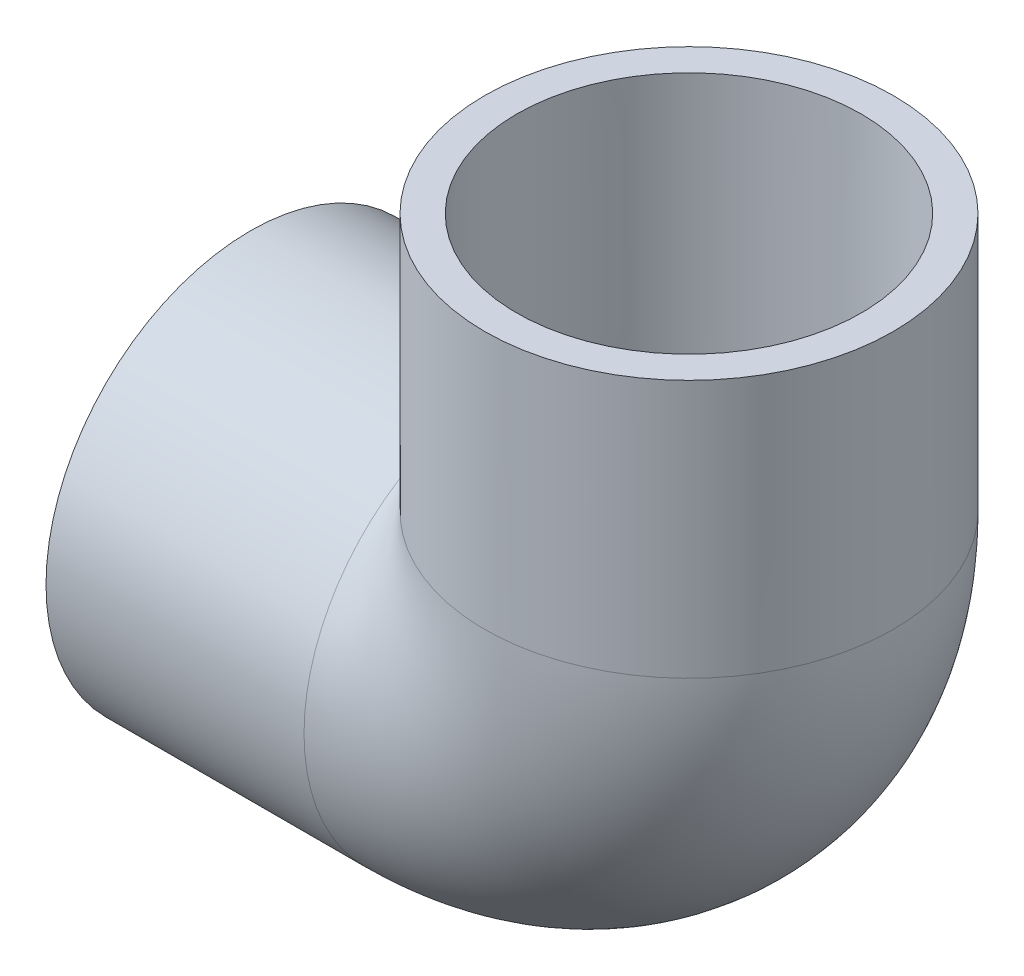
from build123d import *

# Parameters (mm, degrees)
SKETCH3_R   = 25.146
SKETCH3_R_2 = 17.526


with BuildPart() as part:
    # Sketch1 → Revolve1 (revolve)
    with BuildSketch(Plane.XY):
        Polygon((-53.975, -25.146), (-22.225, -25.146), (-22.225, -21.0185), (-53.975, -21.209), align=None)
    revolve(axis=Axis((-53.975, 0, 0), (1, 0, 0)))


with BuildPart() as body_2:
    # Sketch2 → Revolve2 (revolve)
    with BuildSketch(Plane.XY):
        Polygon((21.209, 53.975), (21.0185, 22.225), (25.146, 22.225), (25.146, 53.975), align=None)
    revolve(axis=Axis((0, 0, 0), (0, 1, 0)))


with BuildPart() as sweep1_tool:
    # Sweep1: sweep along a path in Sketch4
    with BuildLine(Plane.XY) as sweep1_path:
        ThreePointArc((-22.225, 0), (-6.509552, 6.509552), (0, 22.225))
    # Sketch3 → Sweep1 (sweep)
    with BuildSketch(Plane(origin=(-22.225, 0, 0), x_dir=(0, 0, -1), z_dir=(1, 0, 0))):
        Circle(SKETCH3_R)
        Circle(SKETCH3_R_2, mode=Mode.SUBTRACT)
    sweep(path=sweep1_path.line)


with BuildPart() as part_1:
    add(part.part)


with BuildPart() as part_2:
    # Sweep1: joined with sweep1_tool
    add(part_1.part.fuse(sweep1_tool.part, body_2.part, tol=0.00001))


solid = part_2.part
